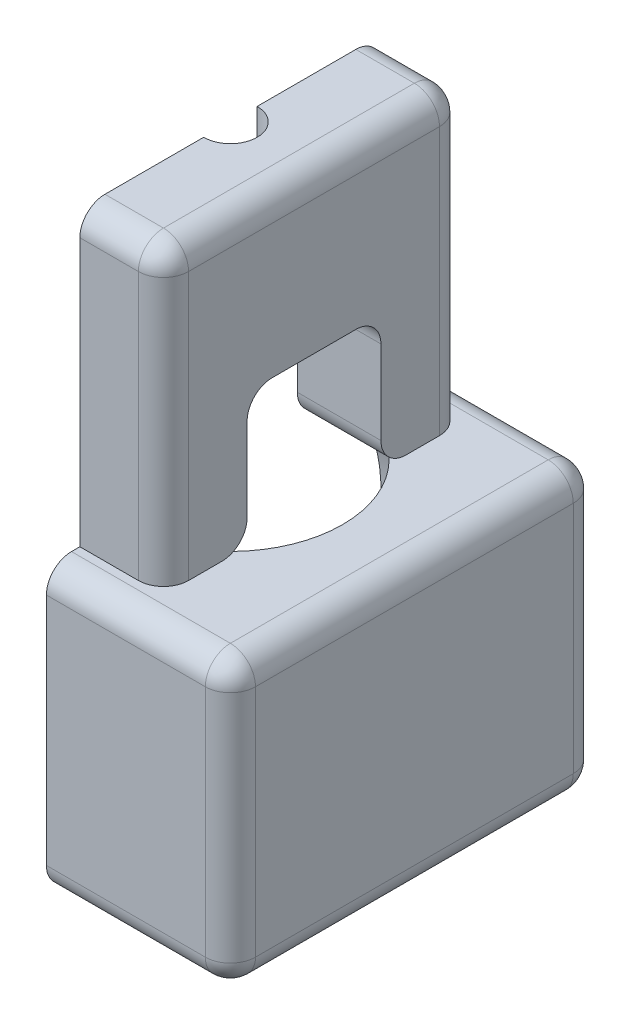
from build123d import *

# Parameters (mm, degrees)
SKETCH_1_W          = 22
SKETCH_1_H          = 17
EXTRUDE_1_DEPTH     = 11
SKETCH_3_W          = 10
SKETCH_3_H          = 17.5
EXTRUDE_2_DEPTH     = 9
SKETCH_4_R          = 1.6
CUT_EXTRUDE_1_DEPTH = 22
SKETCH_5_W          = 8
SKETCH_5_H          = 8
CUT_EXTRUDE_2_DEPTH = 22
FILLET_1_R          = 1.5
FILLET_START        = -6
FILLET_2_DEPTH      = 11
FILLET_START_2      = -5
FILLET_2_2_DEPTH    = 10
SKETCH_7_W          = 37.569031752
SKETCH_7_H          = 53.082934042
CUT_EXTRUDE_4_DEPTH = 22
SKETCH_8_R          = 0.95
EXTRUDE_3_DEPTH     = 1


with BuildPart() as part:
    # 草图1 → 凸台-拉伸1 (new, symmetric)
    with BuildSketch(Plane.XY):
        with Locations((0, -2.5)):
            Rectangle(SKETCH_1_W, SKETCH_1_H)
    extrude(amount=EXTRUDE_1_DEPTH, both=True)

    # 草图2 → 切除-旋转1 (revolve, cut)
    with BuildSketch(Plane.XY, mode=Mode.PRIVATE) as cut_revolve_1_sk:
        with BuildLine():
            Line((0, 6), (6.708203932, 6))
            ThreePointArc((6.708203932, 6), (8.215838363, -3.674234614), (0, -9))
            Line((0, -9), (0, 6))
        make_face()
    revolve(cut_revolve_1_sk.sketch.rotate(Axis((0, 0, 0), (0, 1, 0)), 180), axis=Axis((0, 0, 0), (0, 1, 0)), mode=Mode.SUBTRACT)

    # 草图3 → 凸台-拉伸2 (add, symmetric)
    with BuildSketch(Plane.XY):
        with Locations((0, 14.75)):
            Rectangle(SKETCH_3_W, SKETCH_3_H)
    extrude(amount=EXTRUDE_2_DEPTH, both=True)

    # 草图4 → 切除-拉伸1 (cut)
    with BuildSketch(Plane(origin=(0, 23.5, 0), x_dir=(1, 0, 0), z_dir=(0, 1, 0))):
        with Locations(Location((0, 0, 0), (0, 0, 180))):
            Circle(SKETCH_4_R)
    extrude(amount=-CUT_EXTRUDE_1_DEPTH, mode=Mode.SUBTRACT)

    # 草图5 → 切除-拉伸2 (cut)
    with BuildSketch(Plane.ZY.offset(5)):
        with Locations((0, 10)):
            Rectangle(SKETCH_5_W, SKETCH_5_H)
    extrude(amount=-CUT_EXTRUDE_2_DEPTH, mode=Mode.SUBTRACT)

    # 圆角1
    fillet_1_edges = [part.edges().sort_by_distance(p)[0] for p in [
        (0, -11, 11),
        (11, -2.5, 11),
        (5, 14.75, -9),
        (0, 23.5, -9),
        (5, 23.5, 0),
        (-5, 14.75, -9),
        (-5, 23.5, 0),
        (5, 14.75, 9),
        (0, 23.5, 9),
        (-5, 14.75, 9),
        (0, 6, 11),
        (11, -2.5, -11),
        (0, -11, -11),
        (-11, -2.5, -11),
        (0, 6, -11),
        (11, 6, 0),
        (11, -11, 0),
        (-11, -11, 0),
        (-11, 6, 0),
        (-11, -2.5, 11),
    ]]
    fillet(fillet_1_edges, radius=FILLET_1_R)

    # 圆角2: read off the stored shape, not the designer's step
    # 圆角2 outline → 圆角2 (cut)
    with BuildSketch(Plane.YZ.offset(FILLET_START)):
        with BuildLine():
            Line((6, -4), (6, -5.5))
            ThreePointArc((6, -5.5), (6.439339828, -4.439339828), (7.5, -4))
            Line((7.5, -4), (6, -4))
        make_face()
        with BuildLine():
            Line((6, 4), (7.5, 4))
            ThreePointArc((7.5, 4), (6.439339828, 4.439339828), (6, 5.5))
            Line((6, 5.5), (6, 4))
        make_face()
    extrude(amount=FILLET_2_DEPTH, mode=Mode.SUBTRACT)

    # Fillet 2 2 outline → Fillet 2 2 (add)
    with BuildSketch(Plane.YZ.offset(FILLET_START_2)):
        with BuildLine():
            ThreePointArc((12.5, 4), (13.560660172, 3.560660172), (14, 2.5))
            Line((14, 2.5), (14, 4))
            Line((14, 4), (12.5, 4))
        make_face()
        with BuildLine():
            ThreePointArc((14, -2.5), (13.560660172, -3.560660172), (12.5, -4))
            Line((12.5, -4), (14, -4))
            Line((14, -4), (14, -2.5))
        make_face()
    extrude(amount=FILLET_2_2_DEPTH)

    # 草图7 → 切除-拉伸4 (cut)
    with BuildSketch(Plane(origin=(0, 0, 0), x_dir=(0, 0, -1), z_dir=(1, 0, 0))):
        Rectangle(SKETCH_7_W, SKETCH_7_H)
    extrude(amount=-CUT_EXTRUDE_4_DEPTH, mode=Mode.SUBTRACT)

    # 草图8 → 凸台-拉伸3 (add)
    with BuildSketch(Plane.ZY):
        with Locations(Location((6, 20.5, 0), (0, 0, 180))):
            Circle(SKETCH_8_R)
        with Locations(Location((8.5, -8.5, 0), (0, 0, 180))):
            Circle(SKETCH_8_R)
        with Locations(Location((-6, 20.5, 0), (0, 0, 180))):
            Circle(SKETCH_8_R)
        with Locations(Location((-8.5, -8.5, 0), (0, 0, 180))):
            Circle(SKETCH_8_R)
    extrude(amount=EXTRUDE_3_DEPTH)


solid = part.part
